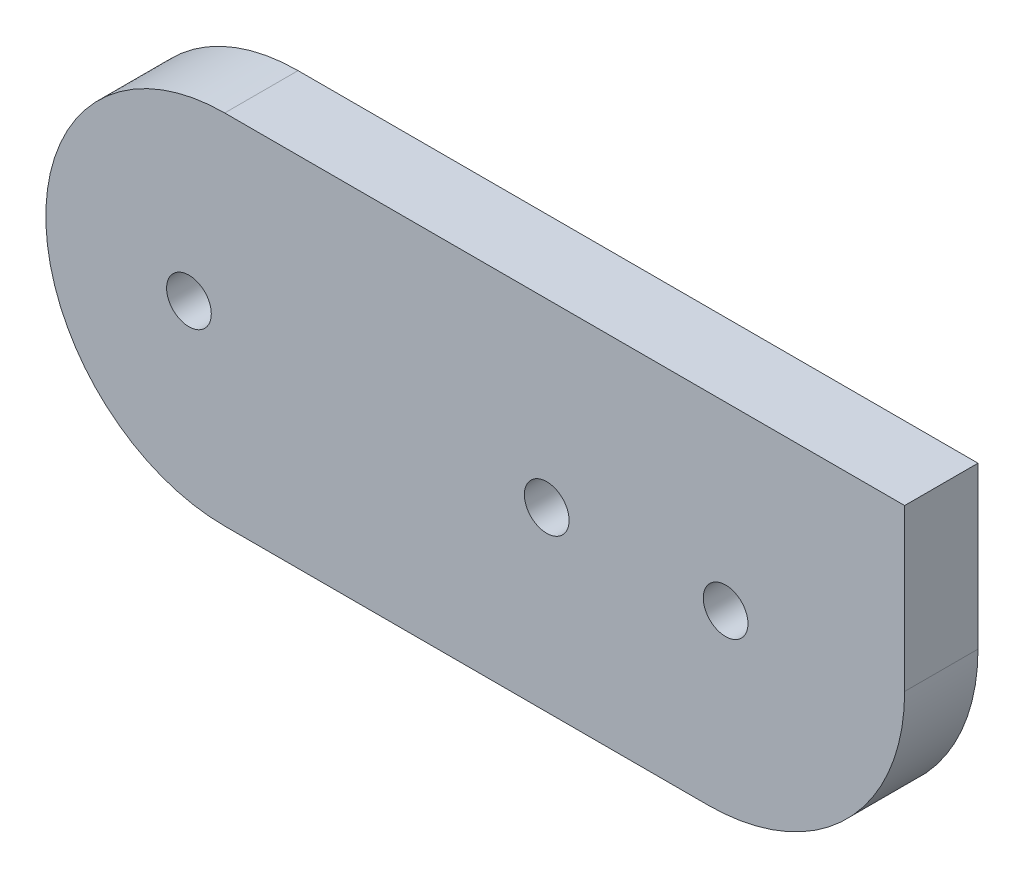
from build123d import *

# Parameters (mm, degrees)
ESTRUSIONE_ESTRUSIONE1_DEPTH = 4.1
SCHIZZO2_R                   = 1.25
TAGLIO_ESTRUSIONE1_DEPTH     = 4.1
RACCORDO1_DEPTH              = 4.1
RACCORDO2_R                  = 11


with BuildPart() as part:
    # Schizzo1 → Estrusione-Estrusione1 (new body)
    with BuildSketch(Plane.XY):
        with BuildLine():
            Line((-12, 0), (-12, 8))
            Line((-12, 8), (23.997894166, 8))
            Line((23.997894166, 8), (38.008621711, 8))
            Line((38.008621711, 8), (38.008621711, -12))
            Line((38.008621711, -12), (0, -12))
            ThreePointArc((0, -12), (-8.485281374, -8.485281374), (-12, 0))
        make_face()
    extrude(amount=ESTRUSIONE_ESTRUSIONE1_DEPTH)

    # Schizzo2 → Taglio-Estrusione1 (cut)
    with BuildSketch(Plane.XY.offset(4.1)):
        with Locations((-2, -2.1)):
            Circle(SCHIZZO2_R)
        with Locations((28, -2.1)):
            Circle(SCHIZZO2_R)
        with Locations((18, -2.1)):
            Circle(SCHIZZO2_R)
    extrude(amount=-TAGLIO_ESTRUSIONE1_DEPTH, mode=Mode.SUBTRACT)

    # Raccordo1: read off the stored shape, not the designer's step
    # Raccordo1 outline → Raccordo1 (cut)
    with BuildSketch(Plane.XY):
        with BuildLine():
            ThreePointArc((-12, 0), (-8.485281374, -8.485281374), (0, -12))
            ThreePointArc((0, -12), (-10, -2), (0, 8))
            Line((0, 8), (-12, 8))
            Line((-12, 8), (-12, 0))
        make_face()
    extrude(amount=RACCORDO1_DEPTH, mode=Mode.SUBTRACT)

    # Raccordo2
    raccordo2_edges = [part.edges().sort_by_distance(p)[0] for p in [
        (38.008621711, -12, 2.05),
    ]]
    fillet(raccordo2_edges, radius=RACCORDO2_R)


solid = part.part
